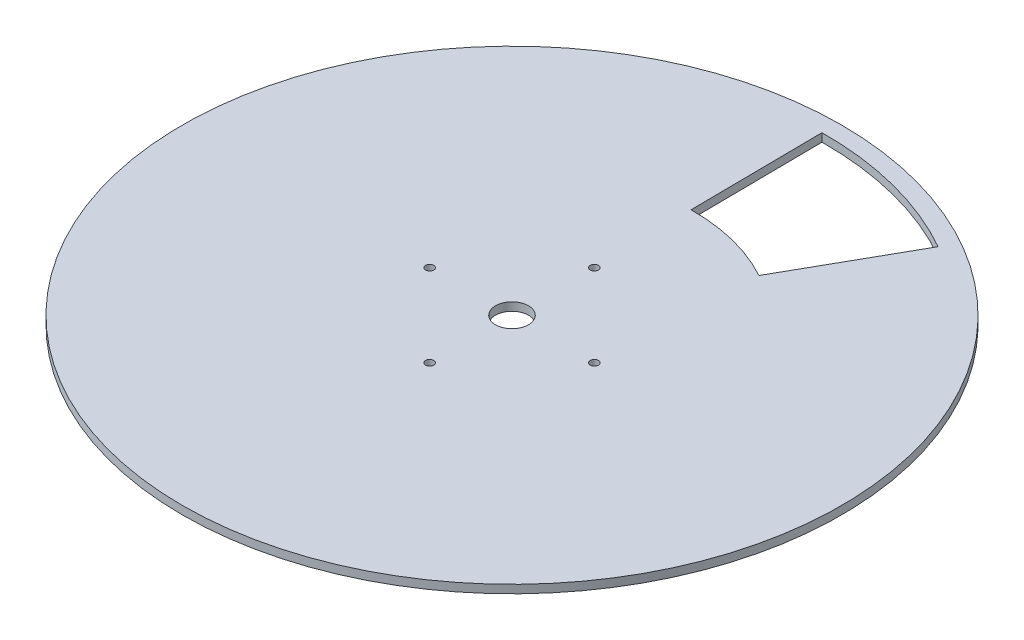
from build123d import *

# Parameters (mm, degrees)
SKETCH1_R           = 127
BOSS_EXTRUDE1_DEPTH = 3.175
SKETCH2_R           = 6.35
CUT_EXTRUDE1_DEPTH  = 180.63318353
CUT_EXTRUDE2_DEPTH  = 180.63318353
SKETCH4_R           = 1.5875
CUT_EXTRUDE3_DEPTH  = 180.63318353
CIRPATTERN1_COUNT   = 4


with BuildPart() as part:
    # Sketch1 → Boss-Extrude1 (new body)
    with BuildSketch(Plane(origin=(0, 0, 0), x_dir=(1, 0, 0), z_dir=(0, 1, 0))):
        Circle(SKETCH1_R)
    extrude(amount=BOSS_EXTRUDE1_DEPTH)

    # Sketch2 → Cut-Extrude1 (cut, through all)
    with BuildSketch(Plane(origin=(0, 3.175, 0), x_dir=(1, 0, 0), z_dir=(0, 1, 0))):
        Circle(SKETCH2_R)
    extrude(amount=-CUT_EXTRUDE1_DEPTH, mode=Mode.SUBTRACT)

    # Sketch3 → Cut-Extrude2 (cut, through all)
    with BuildSketch(Plane(origin=(0, 3.175, 0), x_dir=(1, 0, 0), z_dir=(0, 1, 0))):
        with BuildLine():
            Line((-0.69608151, 69.707591228), (-1.204718825, 120.643985149))
            ThreePointArc((-1.204718825, 120.643985149), (30.046443244, 116.817986877), (59.221085226, 104.981025331))
            Line((59.221085226, 104.981025331), (34.319233166, 60.837593106))
            ThreePointArc((34.319233166, 60.837593106), (17.387075213, 67.544440681), (-0.69608151, 69.707591228))
        make_face()
    extrude(amount=-CUT_EXTRUDE2_DEPTH, mode=Mode.SUBTRACT)

    # Sketch4 → Cut-Extrude3 (cut, through all)
    with BuildSketch(Plane(origin=(0, 3.175, 0), x_dir=(1, 0, 0), z_dir=(0, 1, 0))):
        with Locations((0, -31.75)):
            Circle(SKETCH4_R)
    cut_extrude3 = extrude(amount=-CUT_EXTRUDE3_DEPTH, mode=Mode.SUBTRACT)

    # CirPattern1: Cut-Extrude3 ×4 about axis
    cirpattern1_axis = Axis((0, 0, 0), (0, 1, 0))
    for i in range(1, CIRPATTERN1_COUNT):
        add(cut_extrude3.rotate(cirpattern1_axis, i * 360 / CIRPATTERN1_COUNT), mode=Mode.SUBTRACT)


solid = part.part
